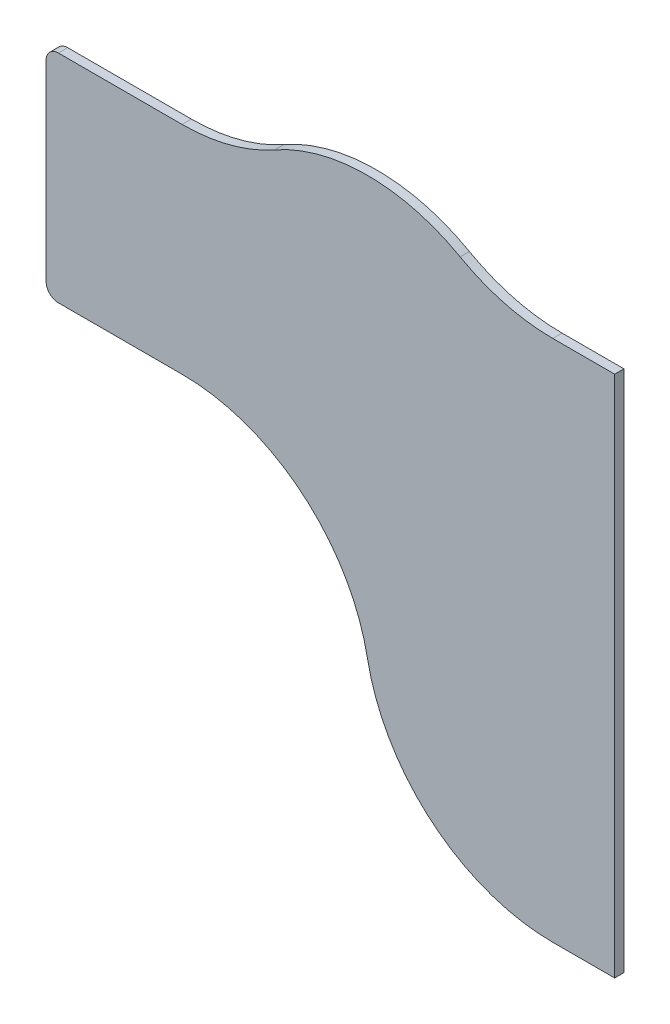
from build123d import *

# Parameters (mm, degrees)
EXTRUDE1_DEPTH = 4.7625
FILLET1_R      = 6.35


with BuildPart() as part:
    # Sketch1 → Extrude1 (new body)
    with BuildSketch(Plane.XY):
        with BuildLine():
            Line((4.7625, 55.5625), (-26.9875, 55.5625))
            ThreePointArc((-26.9875, 55.5625), (-51.590163226, 58.737476051), (-74.58075, 68.054365584))
            ThreePointArc((-74.58075, 68.054365584), (-122.173999999, 80.546231167), (-169.767249999, 68.054365584))
            ThreePointArc((-169.767249999, 68.054365584), (-192.757836773, 58.737476051), (-217.360499999, 55.5625))
            Line((-217.360499999, 55.5625), (-287.210499999, 55.5625))
            Line((-287.210499999, 55.5625), (-287.210499999, -55.5625))
            Line((-287.210499999, -55.5625), (-217.360499999, -55.5625))
            ThreePointArc((-217.360499999, -55.5625), (-155.601522903, -77.790772562), (-122.173999999, -134.278541731))
            ThreePointArc((-122.173999999, -134.278541731), (-88.746477096, -190.766310899), (-26.9875, -212.994583461))
            Line((-26.9875, -212.994583461), (4.7625, -212.994583461))
            Line((4.7625, -212.994583461), (4.7625, 55.5625))
        make_face()
    extrude(amount=-EXTRUDE1_DEPTH)

    # Fillet1
    fillet1_edges = [part.edges().sort_by_distance(p)[0] for p in [
        (-287.210499999, -55.5625, -2.38125),
        (-287.210499999, 55.5625, -2.38125),
    ]]
    fillet(fillet1_edges, radius=FILLET1_R)


solid = part.part
